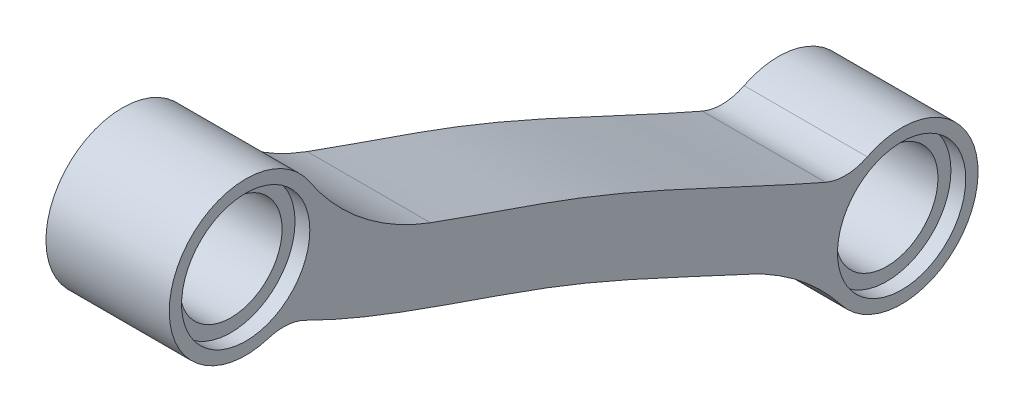
from build123d import *

# Parameters (mm, degrees)
BOSS_EXTRUDE1_START     = -2.5
BOSS_EXTRUDE1_OUTLINE_R = 2.075
BOSS_EXTRUDE1_DEPTH     = 5
FILLET1_R               = 10
FILLET2_R               = 2
SKETCH6_R               = 2.6
CUT_EXTRUDE3_DEPTH      = 0.6
CUT_EXTRUDE4_START      = -0.6
SKETCH7_R               = 2.6
CUT_EXTRUDE4_DEPTH      = 0.6


# Read off the part's stored shape, not the designer's step: Boss-Extrude1
with BuildPart() as part:
    # Boss-Extrude1 outline → Boss-Extrude1 (new body)
    with BuildSketch(Plane(origin=(0, 0, 0), x_dir=(0, 0, -1), z_dir=(1, 0, 0)).offset(BOSS_EXTRUDE1_START)):
        with BuildLine():
            add(Edge.make_bspline(
                [(-11.466730601, 5.359735873), (-11.25264516, 5.245467231), (-10.023154699, 4.613615297), (-6.586726751, 3.178813175), (-1.892828151, 1.72609315), (2.664342093, -0.241853498), (5.954936132, -1.791511585), (8.378645161, -2.904482128), (9.714889181, -3.469566052), (9.963523485, -3.57272868)],
                knots=[0.098312483, 0.098312483, 0.098312483, 0.098312483, 0.125, 0.25, 0.5, 0.625, 0.75, 0.875, 0.903535222, 0.903535222, 0.903535222, 0.903535222], degree=3))
            ThreePointArc((-11.466730601, 5.359735873), (-17.18709042, 7.266876949), (-12.948862581, 2.977689575))
            add(Edge.make_bspline(
                [(-12.948862581, 2.977689575), (-12.654908429, 2.818079718), (-11.233080684, 2.082292793), (-8.617564406, 0.994573419), (-5.134340834, -0.202666732), (-1.7606679, -1.38003851), (1.486902599, -2.78360156), (4.761104026, -4.323813239), (7.2522862, -5.469616162), (8.677110193, -6.070847079), (8.961386544, -6.18832068)],
                knots=[0.09219974, 0.09219974, 0.09219974, 0.09219974, 0.125, 0.25, 0.375, 0.5, 0.625, 0.75, 0.875, 0.905961816, 0.905961816, 0.905961816, 0.905961816], degree=3))
            ThreePointArc((8.961386544, -6.18832068), (14.939800335, -6.979112718), (9.963523485, -3.57272868))
        make_face()
        with Locations((12.045, -5.87)):
            Circle(BOSS_EXTRUDE1_OUTLINE_R, mode=Mode.SUBTRACT)
        with Locations((-14.555, 5.629165125)):
            Circle(BOSS_EXTRUDE1_OUTLINE_R, mode=Mode.SUBTRACT)
    extrude(amount=BOSS_EXTRUDE1_DEPTH)

    # Fillet1
    fillet1_edges = [part.edges().sort_by_distance(p)[0] for p in [
        (0, -6.18832068, -8.961386544),
        (0, 5.359735873, 11.466730601),
    ]]
    fillet(fillet1_edges, radius=FILLET1_R)

    # Fillet2
    fillet2_edges = [part.edges().sort_by_distance(p)[0] for p in [
        (0, -3.57272868, -9.963523485),
        (0, 2.977689575, 12.948862581),
    ]]
    fillet(fillet2_edges, radius=FILLET2_R)

    # Sketch6 → Cut-Extrude3 (cut)
    with BuildSketch(Plane(origin=(2.5, 0, 0), x_dir=(0, 0, -1), z_dir=(1, 0, 0))):
        with Locations((-14.555, 5.629165125)):
            Circle(SKETCH6_R)
        with Locations((12.045, -5.87)):
            Circle(SKETCH6_R)
    extrude(amount=-CUT_EXTRUDE3_DEPTH, mode=Mode.SUBTRACT)

    # Sketch7 → Cut-Extrude4 (cut)
    with BuildSketch(Plane.ZY.offset(2.5).offset(CUT_EXTRUDE4_START)):
        with Locations(Location((14.555, 5.629165125, 0), (0, 0, 180))):
            Circle(SKETCH7_R)
        with Locations(Location((-12.045, -5.87, 0), (0, 0, 180))):
            Circle(SKETCH7_R)
    extrude(amount=CUT_EXTRUDE4_DEPTH, mode=Mode.SUBTRACT)


solid = part.part
